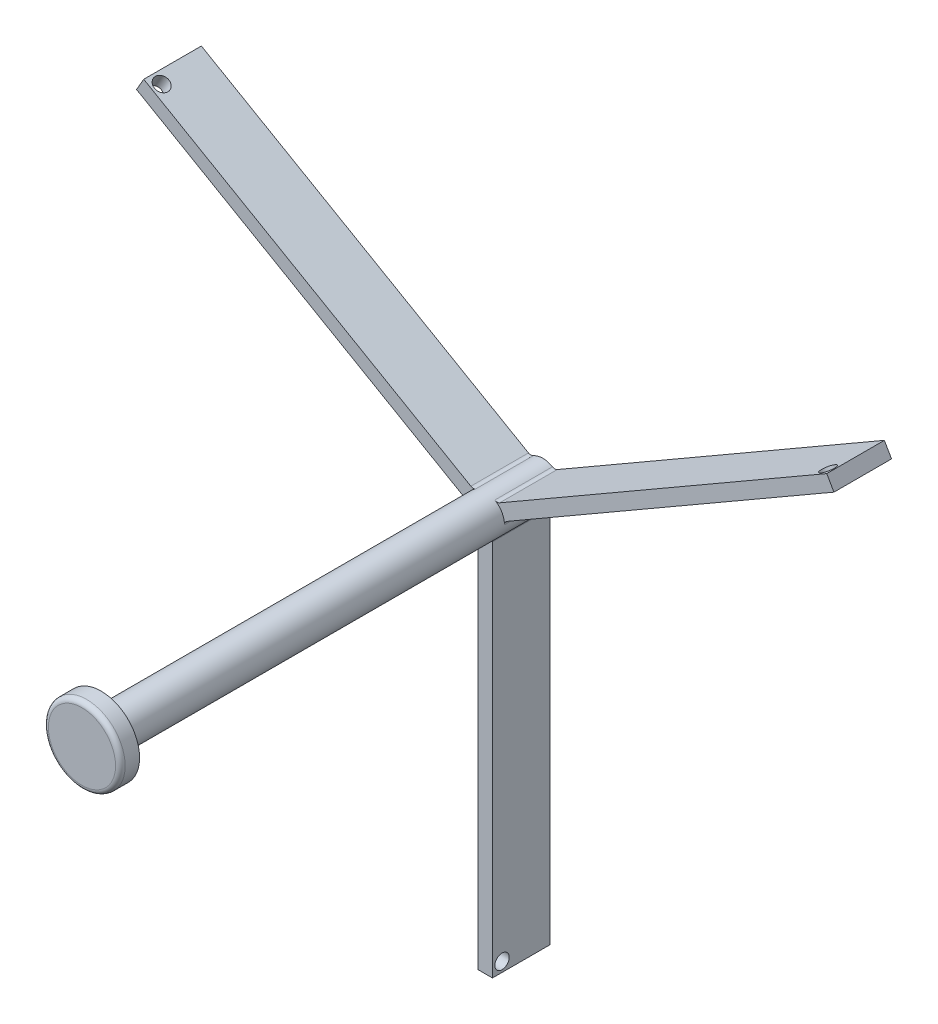
from build123d import *

# Parameters (mm, degrees)
SKETCH1_R           = 12.7
BASE_EXTRUDE_DEPTH  = 304.8
SKETCH2_W           = 9.525
SKETCH2_H           = 38.1
BOSS_EXTRUDE1_DEPTH = 263.525
SKETCH3_R           = 4.7625
CUT_EXTRUDE1_DEPTH  = 404.303117433
CIRPATTERN1_COUNT   = 3
SKETCH4_R           = 4.7625
CUT_EXTRUDE2_DEPTH  = 607.93174528
SKETCH5_R           = 4.7625
CUT_EXTRUDE3_DEPTH  = 542.433342309
CIRPATTERN2_COUNT   = 3
FILLET1_R           = 3.175
FILLET2_R           = 3.175
FILLET3_R           = 3.175
SKETCH13_R          = 25.4
EXTRUDE1_DEPTH      = 12.7
FILLET4_R           = 3.175


with BuildPart() as part:
    # Sketch1 → Base-Extrude (new body)
    with BuildSketch(Plane.XY):
        with Locations(Location((0, 0, 0), (0, 0, 180))):
            Circle(SKETCH1_R)
    extrude(amount=BASE_EXTRUDE_DEPTH)

    # Sketch2 → Boss-Extrude1 (add)
    with BuildSketch(Plane(origin=(0, 0, 0), x_dir=(1, 0, 0), z_dir=(0, 1, 0))):
        with Locations((0, -19.05)):
            Rectangle(SKETCH2_W, SKETCH2_H)
    boss_extrude1 = extrude(amount=-BOSS_EXTRUDE1_DEPTH)

    # Sketch3 → Cut-Extrude1 (cut, through all)
    with BuildSketch(Plane.ZY.offset(4.7625)):
        with Locations((31.75, -257.175)):
            Circle(SKETCH3_R)
    extrude(amount=-CUT_EXTRUDE1_DEPTH, mode=Mode.SUBTRACT)

    # CirPattern1: Boss-Extrude1 ×3 about axis
    cirpattern1_axis = Axis((0, 0, 0), (0, 0, 1))
    for i in range(1, CIRPATTERN1_COUNT):
        add(boss_extrude1.rotate(cirpattern1_axis, i * 360 / CIRPATTERN1_COUNT))

    # Sketch4 → Cut-Extrude2 (cut, through all)
    with BuildSketch(Plane(origin=(-194.392750727, 106.733445647, 225.067730564), x_dir=(0.8660254037844363, -0.5000000000000042, 0), z_dir=(-0.5000000000000041, -0.8660254037844362, 0))):
        with Locations((-35.459216735, -193.317730564)):
            Circle(SKETCH4_R)
    extrude(amount=-CUT_EXTRUDE2_DEPTH, mode=Mode.SUBTRACT)

    # Sketch5 → Cut-Extrude3 (cut, through all)
    with BuildSketch(Plane(origin=(132.010089203, 70.716799223, 223.485963444), x_dir=(0.8660254037844434, 0.499999999999992, 0), z_dir=(0.499999999999992, -0.8660254037844434, 0))):
        with Locations((107.492509583, -191.735963444)):
            Circle(SKETCH5_R)
    extrude(amount=-CUT_EXTRUDE3_DEPTH, mode=Mode.SUBTRACT)

    # Sketch8 → Hole1 (revolve, cut)
    with BuildSketch(Plane(origin=(0, -63.5, 0), x_dir=(0, 1, 0), z_dir=(1, 0, 0))):
        Polygon((0, 0), (0, 8.616645174), (1.130299021, 7.937493125), (1.130299021, 6.3499945), (1.422398768, 6.3499945), (1.422398768, 0.002539998), (1.422398768, 0), align=None)
    hole1 = revolve(axis=Axis((0, -63.5, 0), (0, 0, 1)), mode=Mode.SUBTRACT)

    # Sketch10 → Hole2 (revolve, cut)
    with BuildSketch(Plane(origin=(0, -139.7, 0), x_dir=(0, 1, 0), z_dir=(1, 0, 0))):
        Polygon((0, 0), (0, 8.616645174), (1.130299021, 7.937493125), (1.130299021, 6.3499945), (1.422398768, 6.3499945), (1.422398768, 0.002539998), (1.422398768, 0), align=None)
    hole2 = revolve(axis=Axis((0, -139.7, 0), (0, 0, 1)), mode=Mode.SUBTRACT)

    # Sketch12 → Hole3 (revolve, cut)
    with BuildSketch(Plane(origin=(0, -215.9, 0), x_dir=(0, 1, 0), z_dir=(1, 0, 0))):
        Polygon((0, 0), (0, 8.616645174), (1.130299021, 7.937493125), (1.130299021, 6.3499945), (1.422398768, 6.3499945), (1.422398768, 0.002539998), (1.422398768, 0), align=None)
    hole3 = revolve(axis=Axis((0, -215.9, 0), (0, 0, 1)), mode=Mode.SUBTRACT)

    # CirPattern2: Hole1, Hole2, Hole3 ×3 about axis
    cirpattern2_axis = Axis((0, 0, 0), (0, 0, 1))
    add([hole1.rotate(cirpattern2_axis, i * 360 / CIRPATTERN2_COUNT) for i in range(1, CIRPATTERN2_COUNT)], mode=Mode.SUBTRACT)
    add([hole2.rotate(cirpattern2_axis, i * 360 / CIRPATTERN2_COUNT) for i in range(1, CIRPATTERN2_COUNT)], mode=Mode.SUBTRACT)
    add([hole3.rotate(cirpattern2_axis, i * 360 / CIRPATTERN2_COUNT) for i in range(1, CIRPATTERN2_COUNT)], mode=Mode.SUBTRACT)

    # Fillet1
    fillet1_edges = [part.edges().sort_by_distance(p)[0] for p in [
        (-12.577153359, 1.762161564, 19.05),
        (-4.7625, -11.773215098, 19.05),
    ]]
    fillet(fillet1_edges, radius=FILLET1_R - 0.0001)  # a hair under: the kernel refuses the full size

    # Fillet2
    fillet2_edges = [part.edges().sort_by_distance(p)[0] for p in [
        (7.814653359, 10.011053535, 19.05),
        (-7.814653359, 10.011053535, 19.05),
    ]]
    fillet(fillet2_edges, radius=FILLET2_R)

    # Fillet3
    fillet3_edges = [part.edges().sort_by_distance(p)[0] for p in [
        (12.577153359, 1.762161564, 19.05),
        (4.7625, -11.773215098, 19.05),
    ]]
    fillet(fillet3_edges, radius=FILLET3_R)

    # Sketch13 → Extrude1 (add)
    with BuildSketch(Plane.XY.offset(304.8)):
        Circle(SKETCH13_R)
    extrude(amount=-EXTRUDE1_DEPTH)

    # Fillet4
    fillet4_edges = [part.edges().sort_by_distance(p)[0] for p in [
        (-25.4, 0, 304.8),
    ]]
    fillet(fillet4_edges, radius=FILLET4_R)


solid = part.part
